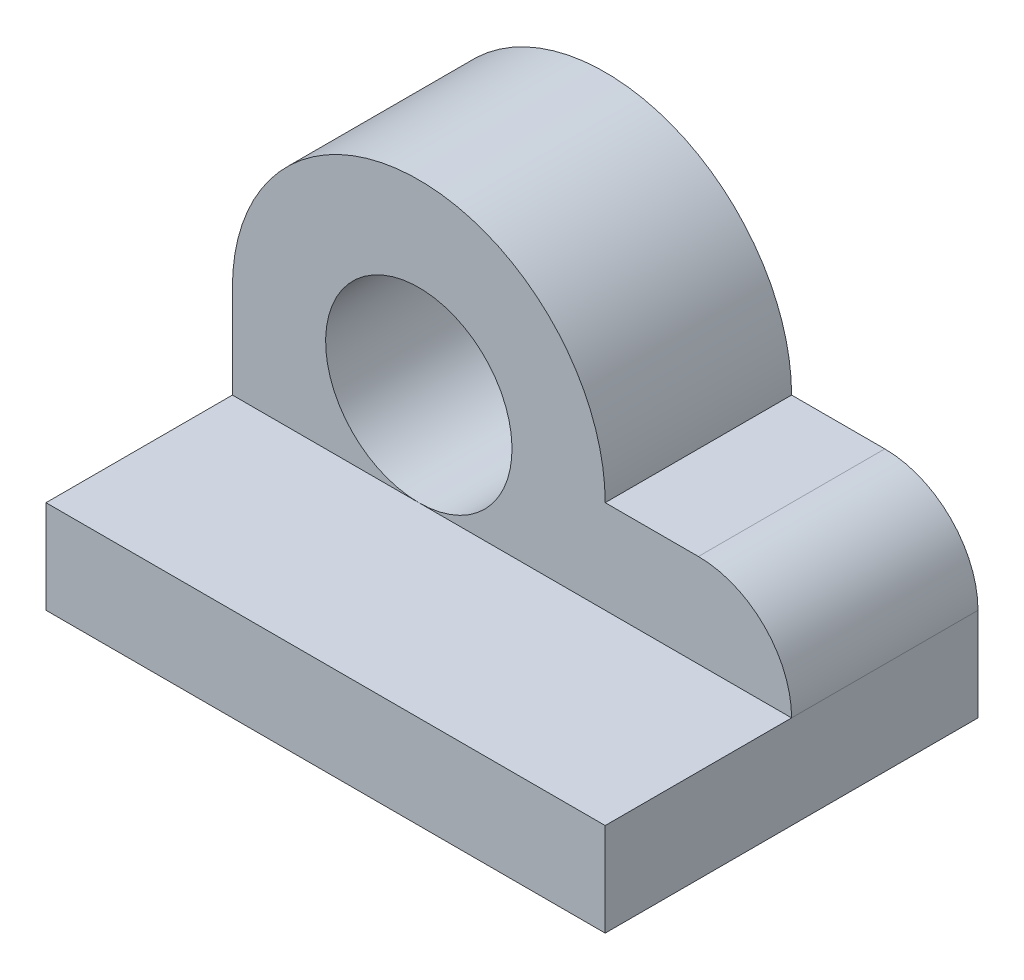
from build123d import *

# Parameters (mm, degrees)
SKETCH1_W           = 60
SKETCH1_H           = 10
BOSS_EXTRUDE2_DEPTH = 40
BOSS_EXTRUDE5_DEPTH = 20
BOSS_EXTRUDE6_DEPTH = 20
FILLET1_R           = 10


with BuildPart() as part:
    # Sketch1 → Boss-Extrude2 (new body)
    with BuildSketch(Plane.XY):
        with Locations((10, 13.392837171)):
            Rectangle(SKETCH1_W, SKETCH1_H)
    extrude(amount=BOSS_EXTRUDE2_DEPTH)

    # Sketch1<6> → Boss-Extrude5 (add)
    with BuildSketch(Plane.XY):
        with BuildLine():
            ThreePointArc((10, 28.392837171), (7.071067812, 21.321769359), (0, 18.392837171))
            Line((0, 18.392837171), (40, 18.392837171))
            Line((40, 18.392837171), (40, 28.392837171))
            Line((40, 28.392837171), (20, 28.392837171))
            ThreePointArc((20, 28.392837171), (14.142135624, 42.534972795), (0, 48.392837171))
            Line((0, 48.392837171), (0, 38.392837171))
            ThreePointArc((0, 38.392837171), (7.071067812, 35.463904983), (10, 28.392837171))
        make_face()
    extrude(amount=BOSS_EXTRUDE5_DEPTH)

    # Sketch1<7> → Boss-Extrude6 (add)
    with BuildSketch(Plane.XY):
        with BuildLine():
            Line((-20, 18.392837171), (0, 18.392837171))
            ThreePointArc((0, 18.392837171), (-10, 28.392837171), (0, 38.392837171))
            Line((0, 38.392837171), (0, 48.392837171))
            ThreePointArc((0, 48.392837171), (-14.142135624, 42.534972795), (-20, 28.392837171))
            Line((-20, 28.392837171), (-20, 18.392837171))
        make_face()
    extrude(amount=BOSS_EXTRUDE6_DEPTH)

    # Fillet1
    fillet1_edges = [part.edges().sort_by_distance(p)[0] for p in [
        (40, 28.392837171, 10),
    ]]
    fillet(fillet1_edges, radius=FILLET1_R)


solid = part.part
